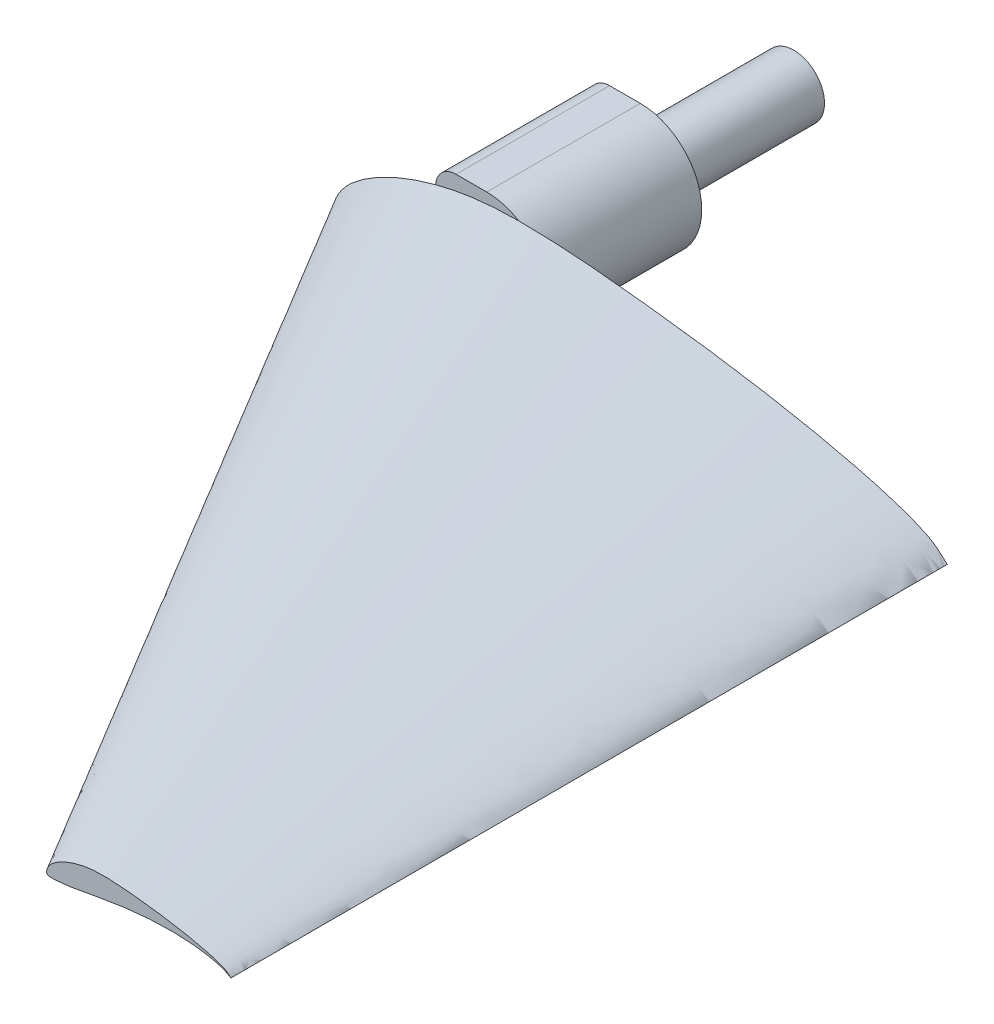
from build123d import *

# Parameters (mm, degrees)
BOSS_EXTRUDE2_DEPTH = 15
SKETCH6_R           = 3
BOSS_EXTRUDE3_DEPTH = 15
FILLET1_START       = -16
FILLET1_DEPTH       = 16


with BuildPart() as part:
    # Sketch3 → Loft1 section 0
    with BuildSketch(Plane.XY.offset(70)):
        with BuildLine():
            add(Edge.make_bspline(
                [(60, 0), (60.000107759, 0.00045823), (59.940935145, 0.044545857), (59.890891538, 0.093647308), (59.779774511, 0.196205337), (59.648682422, 0.305307561), (59.469359582, 0.415294301), (59.246370858, 0.521886024), (58.977168165, 0.633116991), (58.662177205, 0.747496515), (58.302798195, 0.863953961), (57.901335106, 0.982592376), (57.458471962, 1.097979924), (56.979558848, 1.219684363), (56.464360521, 1.335758178), (55.917664884, 1.451163432), (55.342255391, 1.563645721), (54.741619221, 1.672310848), (54.119503088, 1.776862794), (53.479502393, 1.875995081), (52.825753205, 1.969890082), (52.162446062, 2.057806833), (51.494385085, 2.13946315), (50.826910973, 2.215437436), (50.165549402, 2.283812601), (49.515688388, 2.343308945), (48.88189852, 2.390577682), (48.267800241, 2.423092507), (47.676809978, 2.437133923), (47.111955291, 2.435639306), (46.574289852, 2.407982369), (46.063605386, 2.351936832), (45.577823009, 2.272687612), (45.116825477, 2.170020947), (44.681086398, 2.04962996), (44.272449438, 1.913646961), (43.892652493, 1.765251918), (43.544055665, 1.605239875), (43.227776887, 1.436859538), (42.94553682, 1.262025717), (42.699105421, 1.083107561), (42.488584367, 0.903897458), (42.317026583, 0.722439194), (42.185248322, 0.540304202), (42.08790704, 0.363111111), (42.025521579, 0.194874666), (41.995794905, 0.039592478), (42.001532957, -0.091739447), (42.035344873, -0.212191985), (42.16102918, -0.271985507), (42.33001338, -0.28037435), (42.561183137, -0.288504849), (42.85189542, -0.275968725), (43.198864607, -0.252931149), (43.598229294, -0.216029949), (44.045902873, -0.166101037), (44.539702369, -0.102073031), (45.07938647, -0.012584366), (45.667582852, 0.09963297), (46.307232102, 0.221761241), (46.995207664, 0.350711186), (47.72718833, 0.481130505), (48.497798407, 0.608124713), (49.301059449, 0.727453141), (50.130048988, 0.834738394), (50.977312155, 0.926856584), (51.834845451, 0.99967222), (52.694043317, 1.051289527), (53.545929342, 1.07966642), (54.381262057, 1.083250625), (55.190722018, 1.061798612), (55.965040428, 1.015812577), (56.694906217, 0.945885863), (57.371629898, 0.8547026), (57.986400744, 0.744908581), (58.532010839, 0.620180946), (58.99840484, 0.486716819), (59.380100231, 0.344272382), (59.652430067, 0.213917485), (59.853211585, 0.093386968), (59.93034321, 0.046743647), (59.99989005, -0.000467545), (60, 0)],
                knots=[0, 0, 0, 0, 0.000979678, 0.003648865, 0.007483504, 0.012095286, 0.017525603, 0.024051797, 0.031783073, 0.040677857, 0.050710337, 0.061833274, 0.073978206, 0.087117514, 0.1011444, 0.115989999, 0.131569795, 0.147787764, 0.164550314, 0.181757305, 0.199311377, 0.217094507, 0.234989676, 0.252856344, 0.270540067, 0.287886265, 0.304772936, 0.321100929, 0.336805584, 0.351799565, 0.366030606, 0.379615227, 0.392652524, 0.405169929, 0.417171498, 0.428603104, 0.439418554, 0.449596189, 0.459101689, 0.467907493, 0.475987922, 0.483308596, 0.48987414, 0.495802886, 0.501149052, 0.505902717, 0.510046415, 0.51357896, 0.516446578, 0.519349706, 0.523823011, 0.529973455, 0.537715321, 0.546967517, 0.557637048, 0.56962017, 0.582803823, 0.59724667, 0.613134757, 0.630443334, 0.64905587, 0.668822018, 0.68959474, 0.711189442, 0.733426497, 0.756093941, 0.778988394, 0.80188954, 0.824566471, 0.846792174, 0.868338195, 0.888978083, 0.908491945, 0.926658715, 0.943286152, 0.95816918, 0.971135801, 0.98195561, 0.990251784, 0.995852562, 0.999000405, 1, 1, 1, 1], degree=3))
        make_face()
    # Sketch2 → Loft1 section 1
    with BuildSketch(Plane.XY):
        with BuildLine():
            add(Edge.make_bspline(
                [(60, 0), (60.000359197, 0.001527432), (59.80311715, 0.148486191), (59.636305128, 0.312157693), (59.265915035, 0.654017791), (58.828941408, 1.01769187), (58.231198607, 1.384314338), (57.487902859, 1.739620081), (56.590560551, 2.110389969), (55.540590684, 2.491655052), (54.342660651, 2.879846537), (53.004450354, 3.275307919), (51.528239873, 3.659933081), (49.931862826, 4.065614543), (48.21453507, 4.45252726), (46.392216281, 4.837211439), (44.474184637, 5.212152404), (42.47206407, 5.574369492), (40.398343628, 5.92287598), (38.265007978, 6.253316937), (36.085844017, 6.566300275), (33.874820207, 6.859356111), (31.647950283, 7.131543832), (29.423036576, 7.384791452), (27.218498007, 7.612708672), (25.052294626, 7.811029816), (22.939661735, 7.968592274), (20.892667469, 8.076975023), (18.922699926, 8.123779744), (17.039850969, 8.118797688), (15.247632842, 8.026607898), (13.545351286, 7.839789441), (11.926076695, 7.575625373), (10.389418256, 7.233403155), (8.93695466, 6.832099867), (7.574831461, 6.378823205), (6.308841643, 5.884173059), (5.146852216, 5.350799583), (4.092589623, 4.789531794), (3.151789401, 4.20675239), (2.330351404, 3.610358538), (1.628614556, 3.012991527), (1.056755276, 2.408130647), (0.617494407, 1.801014007), (0.293023466, 1.210370369), (0.085071932, 0.649582219), (-0.014016985, 0.131974926), (0.005109858, -0.305798158), (0.117816245, -0.707306616), (0.536763933, -0.906618356), (1.100044602, -0.934581165), (1.870610456, -0.96168283), (2.8396514, -0.91989575), (3.996215358, -0.843103831), (5.32743098, -0.720099828), (6.819676242, -0.553670124), (8.465674563, -0.340243438), (10.264621567, -0.041947886), (12.225276175, 0.332109901), (14.357440339, 0.739204138), (16.650692214, 1.169037288), (19.090627767, 1.60376835), (21.659328024, 2.027082377), (24.336864829, 2.424843805), (27.100163295, 2.782461315), (29.924373851, 3.089521947), (32.78281817, 3.332240734), (35.646811058, 3.504298425), (38.486431141, 3.598888068), (41.270873525, 3.610835418), (43.969073393, 3.539328707), (46.550134759, 3.386041923), (48.983020725, 3.152952876), (51.238766327, 2.849008665), (53.28800248, 2.483028604), (55.106702797, 2.06726982), (56.661349467, 1.622389398), (57.933667436, 1.147574605), (58.841433556, 0.713058282), (59.510705283, 0.311289894), (59.767810701, 0.155812155), (59.999633501, -0.001558484), (60, 0)],
                knots=[0, 0, 0, 0, 0.000979678, 0.003648865, 0.007483504, 0.012095286, 0.017525603, 0.024051797, 0.031783073, 0.040677857, 0.050710337, 0.061833274, 0.073978206, 0.087117514, 0.1011444, 0.115989999, 0.131569795, 0.147787764, 0.164550314, 0.181757305, 0.199311377, 0.217094507, 0.234989676, 0.252856344, 0.270540067, 0.287886265, 0.304772936, 0.321100929, 0.336805584, 0.351799565, 0.366030606, 0.379615227, 0.392652524, 0.405169929, 0.417171498, 0.428603104, 0.439418554, 0.449596189, 0.459101689, 0.467907493, 0.475987922, 0.483308596, 0.48987414, 0.495802886, 0.501149052, 0.505902717, 0.510046415, 0.51357896, 0.516446578, 0.519349706, 0.523823011, 0.529973455, 0.537715321, 0.546967517, 0.557637048, 0.56962017, 0.582803823, 0.59724667, 0.613134757, 0.630443334, 0.64905587, 0.668822018, 0.68959474, 0.711189442, 0.733426497, 0.756093941, 0.778988394, 0.80188954, 0.824566471, 0.846792174, 0.868338195, 0.888978083, 0.908491945, 0.926658715, 0.943286152, 0.95816918, 0.971135801, 0.98195561, 0.990251784, 0.995852562, 0.999000405, 1, 1, 1, 1], degree=3))
        make_face()
    loft()

    # Sketch5 → Boss-Extrude2 (add)
    with BuildSketch(Plane.XY):
        with BuildLine():
            Line((10, 9), (15, 9))
            ThreePointArc((15, 9), (21, 3), (15, -3))
            Line((15, -3), (10, -3))
            Line((10, -3), (10, 9))
        make_face()
    extrude(amount=-BOSS_EXTRUDE2_DEPTH)

    # Sketch6 → Boss-Extrude3 (add)
    with BuildSketch(Plane(origin=(0, 0, -15), x_dir=(-1, 0, 0), z_dir=(0, 0, -1))):
        with Locations((-15, 3)):
            Circle(SKETCH6_R)
    extrude(amount=BOSS_EXTRUDE3_DEPTH)

    # Fillet1: read off the stored shape, not the designer's step
    # Fillet1 outline → Fillet1 (cut)
    with BuildSketch(Plane.XY.offset(FILLET1_START)):
        with BuildLine():
            Line((10, 9), (10, 7))
            ThreePointArc((10, 7), (10.585786438, 8.414213562), (12, 9))
            Line((12, 9), (10, 9))
        make_face()
        with BuildLine():
            ThreePointArc((12, -3), (10.585786438, -2.414213562), (10, -1))
            Line((10, -1), (10, -3))
            Line((10, -3), (12, -3))
        make_face()
    extrude(amount=FILLET1_DEPTH, mode=Mode.SUBTRACT)


solid = part.part
